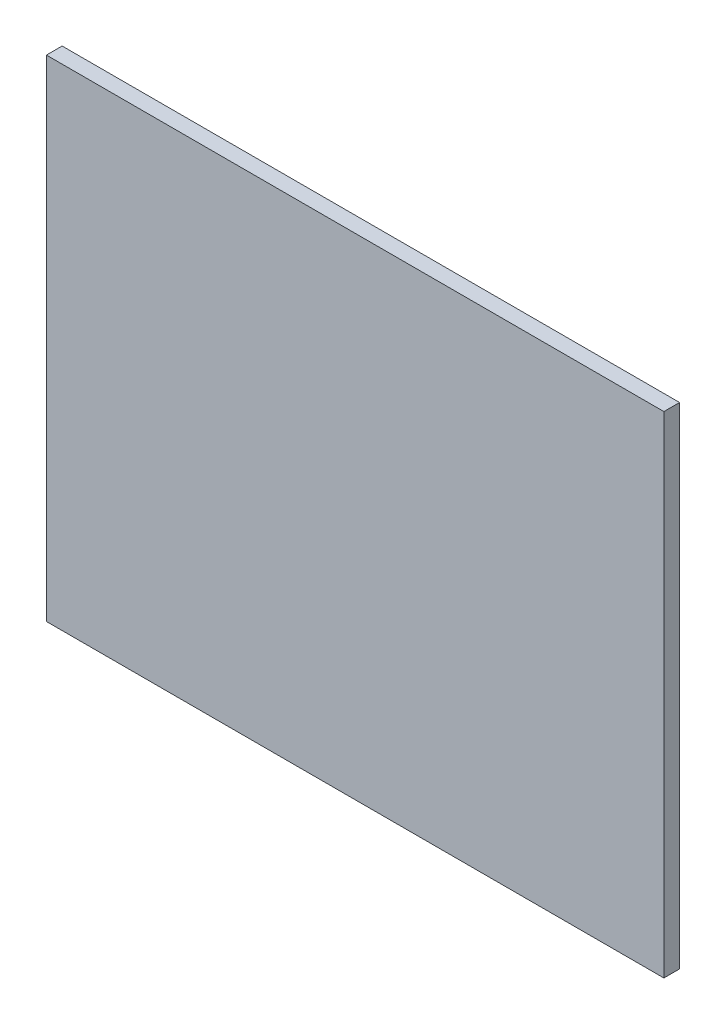
from build123d import *

# Parameters (mm, degrees)
CROQUIS1_W              = 472
CROQUIS1_H              = 375
SALIENTE_EXTRUIR1_DEPTH = 6
CROQUIS2_R              = 3
CORTAR_EXTRUIR1_DEPTH   = 12


with BuildPart() as part:
    # Croquis1 → Saliente-Extruir1 (new, symmetric)
    with BuildSketch(Plane.XY):
        Rectangle(CROQUIS1_W, CROQUIS1_H)
    extrude(amount=SALIENTE_EXTRUIR1_DEPTH, both=True)

    # Croquis2 → Cortar-Extruir1 (cut)
    with BuildSketch(Plane.XY):
        with Locations((-176.65, 181.5)):
            Circle(CROQUIS2_R)
        with Locations((-230, 70)):
            Circle(CROQUIS2_R)
        with Locations((-230, 140)):
            Circle(CROQUIS2_R)
        with Locations((-106.65, 181.5)):
            Circle(CROQUIS2_R)
        with Locations((-36.65, 181.5)):
            Circle(CROQUIS2_R)
        with Locations((36.65, 181.5)):
            Circle(CROQUIS2_R)
        with Locations((106.65, 181.5)):
            Circle(CROQUIS2_R)
        with Locations((-230, -140)):
            Circle(CROQUIS2_R)
        with Locations((-230, -70)):
            Circle(CROQUIS2_R)
        with Locations((230, -140)):
            Circle(CROQUIS2_R)
        with Locations((230, -70)):
            Circle(CROQUIS2_R)
        with Locations((230, 70)):
            Circle(CROQUIS2_R)
        with Locations((230, 140)):
            Circle(CROQUIS2_R)
        with Locations((176.65, 181.5)):
            Circle(CROQUIS2_R)
    extrude(amount=-CORTAR_EXTRUIR1_DEPTH, mode=Mode.SUBTRACT)


solid = part.part
